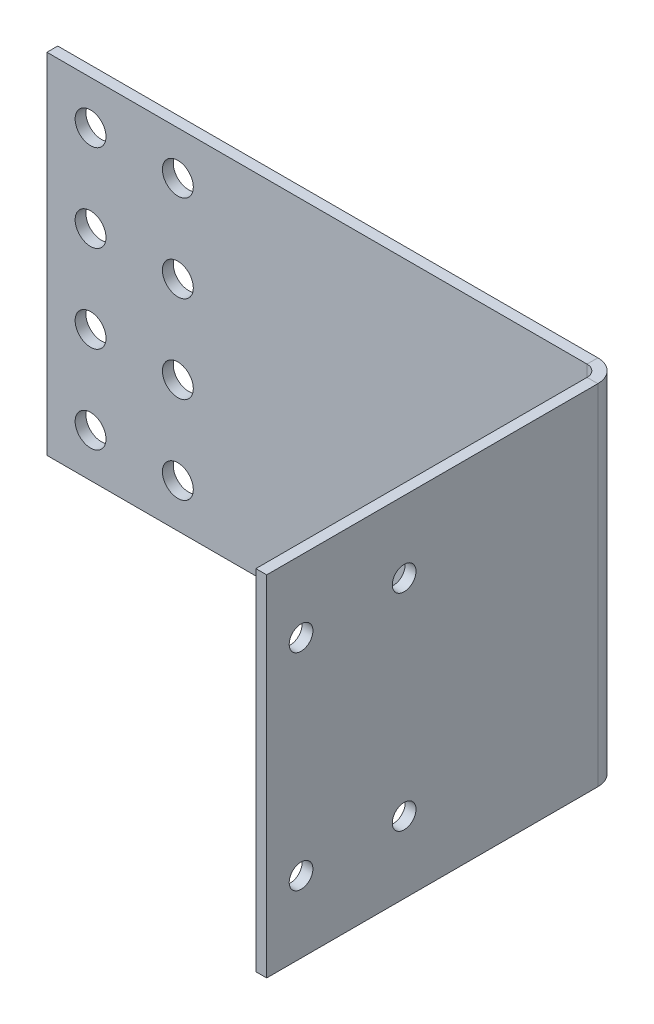
from build123d import *

# Parameters (mm, degrees)
SKETCH1_R                  = 2.2479
SKETCH1_R_2                = 1.725
BASE_FLANGE1_DEPTH         = 1.5748
SKETCHED_START             = 68.796428764
SKETCHED_BEND1_OUTLINE_W   = 50.8
SKETCHED_BEND1_OUTLINE_H   = 1.5748
SKETCHED_BEND1_DEPTH       = 48.903571236
SKETCHED_START_2           = 65.888620508
SKETCHED_BEND1_2_OUTLINE_W = 50.8
SKETCHED_BEND1_2_OUTLINE_H = 49.865020508
SKETCHED_BEND1_2_OUTLINE_R = 1.725
SKETCHED_BEND1_2_DEPTH     = 3.2512
SKETCHED_START_3           = -26
SKETCHED_BEND1_3_DEPTH     = 52


with BuildPart() as part:
    # Base-Flange1: sheet metal written as solids
    # Sketch1 → Base-Flange1 (new body)
    with BuildSketch(Plane.XY):
        Polygon((12.7, 25.4), (117.7, 25.4), (117.7, -25.4), (12.7, -25.4), (-12.7, -25.4), (-12.7, 25.4), align=None)
        with Locations((-6.35, 19.05)):
            Circle(SKETCH1_R, mode=Mode.SUBTRACT)
        with Locations((6.35, 19.05)):
            Circle(SKETCH1_R, mode=Mode.SUBTRACT)
        with Locations((6.35, 6.35)):
            Circle(SKETCH1_R, mode=Mode.SUBTRACT)
        with Locations((6.35, -6.35)):
            Circle(SKETCH1_R, mode=Mode.SUBTRACT)
        with Locations((6.35, -19.05)):
            Circle(SKETCH1_R, mode=Mode.SUBTRACT)
        with Locations((-6.35, 6.35)):
            Circle(SKETCH1_R, mode=Mode.SUBTRACT)
        with Locations((-6.35, -6.35)):
            Circle(SKETCH1_R, mode=Mode.SUBTRACT)
        with Locations((-6.35, -19.05)):
            Circle(SKETCH1_R, mode=Mode.SUBTRACT)
        with Locations((97.7, 15)):
            Circle(SKETCH1_R_2, mode=Mode.SUBTRACT)
        with Locations((112.7, 15)):
            Circle(SKETCH1_R_2, mode=Mode.SUBTRACT)
        with Locations((112.7, -15)):
            Circle(SKETCH1_R_2, mode=Mode.SUBTRACT)
        with Locations((97.7, -15)):
            Circle(SKETCH1_R_2, mode=Mode.SUBTRACT)
    extrude(amount=-BASE_FLANGE1_DEPTH)

    # Sketched Bend1: read off the stored shape, not the designer's step
    # Sketched Bend1 outline → Sketched Bend1 (cut)
    with BuildSketch(Plane.YZ.offset(SKETCHED_START)):
        with Locations((0, -0.7874)):
            Rectangle(SKETCHED_BEND1_OUTLINE_W, SKETCHED_BEND1_OUTLINE_H)
    extrude(amount=SKETCHED_BEND1_DEPTH, mode=Mode.SUBTRACT)

    # Sketched Bend1 2 outline → Sketched Bend1 2 (add)
    with BuildSketch(Plane.YZ.offset(SKETCHED_START_2)):
        with Locations((0, 24.932510254)):
            Rectangle(SKETCHED_BEND1_2_OUTLINE_W, SKETCHED_BEND1_2_OUTLINE_H)
        with Locations((-15, 29.865020508)):
            Circle(SKETCHED_BEND1_2_OUTLINE_R, mode=Mode.SUBTRACT)
        with Locations((-15, 44.865020508)):
            Circle(SKETCHED_BEND1_2_OUTLINE_R, mode=Mode.SUBTRACT)
        with Locations((15, 29.865020508)):
            Circle(SKETCHED_BEND1_2_OUTLINE_R, mode=Mode.SUBTRACT)
        with Locations((15, 44.865020508)):
            Circle(SKETCHED_BEND1_2_OUTLINE_R, mode=Mode.SUBTRACT)
    extrude(amount=SKETCHED_BEND1_2_DEPTH)

    # Sketched Bend1 3 outline → Sketched Bend1 3 (cut)
    with BuildSketch(Plane(origin=(0, 0, 0), x_dir=(1, 0, 0), z_dir=(0, 1, 0)).offset(SKETCHED_START_3)):
        with BuildLine():
            ThreePointArc((65.888620508, 1.5748), (68.187566075, 0.622545567), (69.139820508, -1.6764))
            Line((69.139820508, -1.6764), (69.139820508, 0))
            Line((69.139820508, 0), (68.796428764, 0))
            Line((68.796428764, 0), (68.796428764, 1.5748))
            Line((68.796428764, 1.5748), (65.888620508, 1.5748))
        make_face()
        with BuildLine():
            Line((67.565020508, -49.865020508), (67.565020508, -1.6764))
            ThreePointArc((67.565020508, -1.6764), (67.074014316, -0.491006192), (65.888620508, 0))
            Line((65.888620508, 0), (65.888620508, -49.865020508))
            Line((65.888620508, -49.865020508), (67.565020508, -49.865020508))
        make_face()
    extrude(amount=SKETCHED_BEND1_3_DEPTH, mode=Mode.SUBTRACT)


solid = part.part
